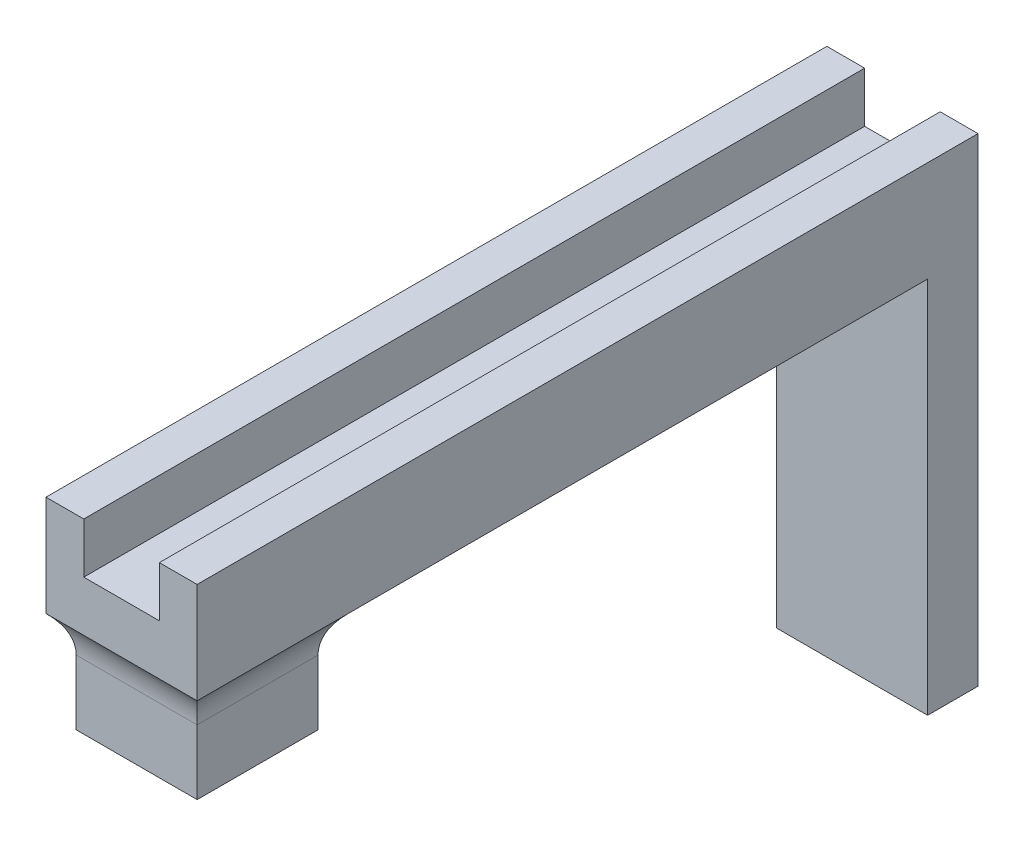
from build123d import *

# Parameters (mm, degrees)
SKETCH1_W           = 6.096
SKETCH1_H           = 6.096
BOSS_EXTRUDE1_DEPTH = 5.08
SKETCH2_W           = 7.62
SKETCH2_H           = 7.62
BOSS_EXTRUDE2_DEPTH = 5.08
FILLET1_R           = 2.54
FILLET2_R           = 2.54
SKETCH4_W           = 7.62
SKETCH4_H           = 5.08
BOSS_EXTRUDE4_DEPTH = 31.75
SKETCH5_W           = 3.81
SKETCH5_H           = 39.37
CUT_EXTRUDE1_DEPTH  = 2.54
SKETCH7_W           = 7.62
SKETCH7_H           = 2.54
BOSS_EXTRUDE5_DEPTH = 19.05


with BuildPart() as part:
    # Sketch1 → Boss-Extrude1 (new body)
    with BuildSketch(Plane(origin=(0, 0, 0), x_dir=(1, 0, 0), z_dir=(0, 1, 0))):
        with Locations((3.048, 3.048)):
            Rectangle(SKETCH1_W, SKETCH1_H)
    extrude(amount=BOSS_EXTRUDE1_DEPTH)

    # Sketch2 → Boss-Extrude2 (add)
    with BuildSketch(Plane(origin=(0, 5.08, 0), x_dir=(1, 0, 0), z_dir=(0, 1, 0))):
        with Locations((3.048, 3.048)):
            Rectangle(SKETCH2_W, SKETCH2_H)
    extrude(amount=BOSS_EXTRUDE2_DEPTH)

    # Fillet1
    # the kernel refuses this fillet: 2.54 mm, written as the material it adds along each edge
    with BuildSketch(Plane(origin=(0, 5.08, -6.096), x_dir=(-1, 0, 0), z_dir=(0, 0, 1))) as fillet1_piece_1:
        with BuildLine():
            CenterArc((2.54, 1.813922821), FILLET1_R, 180, 45.572995999)
            Line((0, 1.813922821), (-0.0508, 1.813922821))
            Line((-0.0508, 1.813922821), (-0.0508, 0))
            Line((-0.0508, 0), (0, -0.0508))
            ThreePointArc((0, -0.0508), (0.381, -0.0508), (0.72644, -0.036278456))
            Line((0.72644, -0.036278456), (0.762, 0))
        make_face()
    extrude(amount=6.096)

    # Fillet2
    # the kernel refuses this fillet: 2.54 mm, written as the material it adds along each edge
    with BuildSketch(Plane(origin=(6.096, 5.08, 0), x_dir=(0, -1, 0), z_dir=(-1, 0, 0))) as fillet2_piece_1_section:
        with BuildLine():
            CenterArc((1.813922821, 2.54), FILLET2_R, 224.427004001, 45.572995999)
            Line((0, 0.762), (-0.036278456, 0.72644))
            ThreePointArc((-0.036278456, 0.72644), (-0.0508, 0.381), (-0.0508, 0))
            Line((-0.0508, 0), (0, -0.0508))
            Line((0, -0.0508), (1.813922821, -0.0508))
            Line((1.813922821, -0.0508), (1.813922821, 0))
        make_face()
    fillet2_piece_1 = extrude(amount=6.858, mode=Mode.PRIVATE)
    fillet2_piece_1 = fillet2_piece_1 - Plane(origin=(-2.54, 3.266077179, 0.188412047), x_dir=(-1, 0, 0), z_dir=(0, 0, -1)) * Cylinder(2.54, 21, mode=Mode.PRIVATE)
    add(fillet2_piece_1)
    with BuildSketch(Plane(origin=(6.096, 5.08, 0), x_dir=(0, -1, 0), z_dir=(0, 0, -1))) as fillet2_piece_2:
        with BuildLine():
            CenterArc((1.813922821, -2.54), FILLET2_R, 90, 45.572995999)
            Line((0, -0.762), (-0.036278456, -0.72644))
            ThreePointArc((-0.036278456, -0.72644), (-0.0508, -0.381), (-0.0508, 0))
            Line((-0.0508, 0), (0, 0.0508))
            Line((0, 0.0508), (1.813922821, 0.0508))
            Line((1.813922821, 0.0508), (1.813922821, 0))
        make_face()
    extrude(amount=6.096)
    with BuildSketch(Plane(origin=(-0.762, 5.08, -6.096), x_dir=(0, 0, -1), z_dir=(1, 0, 0))) as fillet2_piece_3_section:
        with BuildLine():
            CenterArc((2.54, -1.813922821), FILLET2_R, 134.427004001, 45.572995999)
            Line((0, -1.813922821), (-0.0508, -1.813922821))
            Line((-0.0508, -1.813922821), (-0.0508, 0))
            Line((-0.0508, 0), (0, 0.0508))
            ThreePointArc((0, 0.0508), (0.381, 0.0508), (0.72644, 0.036278456))
            Line((0.72644, 0.036278456), (0.762, 0))
        make_face()
    fillet2_piece_3 = extrude(amount=6.858, mode=Mode.PRIVATE)
    fillet2_piece_3 = fillet2_piece_3 - Plane(origin=(-2.54, 3.266077179, -6.345051063), x_dir=(-1, 0, 0), z_dir=(0, 0, -1)) * Cylinder(2.54, 21, mode=Mode.PRIVATE)
    add(fillet2_piece_3)
    with BuildSketch(Plane(origin=(10.630807052, 5.08, 0), x_dir=(0, -1, 0), z_dir=(-1, 0, 0))) as fillet2_piece_4a_section:
        with BuildLine():
            CenterArc((1.813922821, 2.54), FILLET2_R, 224.427004001, 45.572995999)
            Line((0, 0.762), (-0.036278456, 0.72644))
            ThreePointArc((-0.036278456, 0.72644), (-0.0508, 0.381), (-0.0508, 0))
            Line((-0.0508, 0), (0, -0.0508))
            Line((0, -0.0508), (1.813922821, -0.0508))
            Line((1.813922821, -0.0508), (1.813922821, 0))
        make_face()
    fillet2_piece_4a = extrude(amount=11.392807052, mode=Mode.PRIVATE)
    fillet2_piece_4a = split(fillet2_piece_4a, bisect_by=Plane(origin=(6.096, 4.594869389, 0.188412047), z_dir=(1, 0, 0)), keep=Keep.TOP, mode=Mode.PRIVATE)
    fillet2_piece_4a = split(fillet2_piece_4a, bisect_by=Plane(origin=(6.858, 4.594869389, 0.188412047), z_dir=(-1, 0, 0)), keep=Keep.TOP, mode=Mode.PRIVATE)
    with BuildSketch(Plane(origin=(6.096, 5.08, 4.534807052), x_dir=(0, -1, 0), z_dir=(0, 0, -1))) as fillet2_piece_4b_section:
        with BuildLine():
            CenterArc((1.813922821, -2.54), FILLET2_R, 90, 45.572995999)
            Line((0, -0.762), (-0.036278456, -0.72644))
            ThreePointArc((-0.036278456, -0.72644), (-0.0508, -0.381), (-0.0508, 0))
            Line((-0.0508, 0), (0, 0.0508))
            Line((0, 0.0508), (1.813922821, 0.0508))
            Line((1.813922821, 0.0508), (1.813922821, 0))
        make_face()
    fillet2_piece_4b = extrude(amount=10.630807052, mode=Mode.PRIVATE)
    fillet2_piece_4b = split(fillet2_piece_4b, bisect_by=Plane(origin=(6.284412047, 4.594869389, 0), z_dir=(0, 0, 1)), keep=Keep.TOP, mode=Mode.PRIVATE)
    fillet2_piece_4b = split(fillet2_piece_4b, bisect_by=Plane(origin=(6.284412047, 4.594869389, 0.762), z_dir=(0, 0, -1)), keep=Keep.TOP, mode=Mode.PRIVATE)
    fillet2_piece_4 = fillet2_piece_4a & fillet2_piece_4b
    add(fillet2_piece_4)
    with BuildSketch(Plane(origin=(6.096, 5.08, 0), x_dir=(0, -1, 0), z_dir=(0, 0, -1))) as fillet2_piece_5a_section:
        with BuildLine():
            CenterArc((1.813922821, -2.54), FILLET2_R, 90, 45.572995999)
            Line((0, -0.762), (-0.036278456, -0.72644))
            ThreePointArc((-0.036278456, -0.72644), (-0.0508, -0.381), (-0.0508, 0))
            Line((-0.0508, 0), (0, 0.0508))
            Line((0, 0.0508), (1.813922821, 0.0508))
            Line((1.813922821, 0.0508), (1.813922821, 0))
        make_face()
    fillet2_piece_5a = extrude(amount=10.630807052, mode=Mode.PRIVATE)
    fillet2_piece_5a = split(fillet2_piece_5a, bisect_by=Plane(origin=(6.284412047, 4.594869389, -6.096), z_dir=(0, 0, -1)), keep=Keep.TOP, mode=Mode.PRIVATE)
    fillet2_piece_5a = split(fillet2_piece_5a, bisect_by=Plane(origin=(6.284412047, 4.594869389, -6.858), z_dir=(0, 0, 1)), keep=Keep.TOP, mode=Mode.PRIVATE)
    with BuildSketch(Plane(origin=(-0.762, 5.08, -6.096), x_dir=(0, 0, -1), z_dir=(1, 0, 0))) as fillet2_piece_5b_section:
        with BuildLine():
            CenterArc((2.54, -1.813922821), FILLET2_R, 134.427004001, 45.572995999)
            Line((0, -1.813922821), (-0.0508, -1.813922821))
            Line((-0.0508, -1.813922821), (-0.0508, 0))
            Line((-0.0508, 0), (0, 0.0508))
            ThreePointArc((0, 0.0508), (0.381, 0.0508), (0.72644, 0.036278456))
            Line((0.72644, 0.036278456), (0.762, 0))
        make_face()
    fillet2_piece_5b = extrude(amount=11.392807052, mode=Mode.PRIVATE)
    fillet2_piece_5b = split(fillet2_piece_5b, bisect_by=Plane(origin=(6.096, 4.594869389, -6.284412047), z_dir=(1, 0, 0)), keep=Keep.TOP, mode=Mode.PRIVATE)
    fillet2_piece_5b = split(fillet2_piece_5b, bisect_by=Plane(origin=(6.858, 4.594869389, -6.284412047), z_dir=(-1, 0, 0)), keep=Keep.TOP, mode=Mode.PRIVATE)
    fillet2_piece_5 = fillet2_piece_5a & fillet2_piece_5b
    add(fillet2_piece_5)

    # Sketch4 → Boss-Extrude4 (add)
    with BuildSketch(Plane(origin=(0, 0, -6.858), x_dir=(-1, 0, 0), z_dir=(0, 0, -1))):
        with Locations((-3.048, 7.62)):
            Rectangle(SKETCH4_W, SKETCH4_H)
    extrude(amount=BOSS_EXTRUDE4_DEPTH)

    # Sketch5 → Cut-Extrude1 (cut)
    with BuildSketch(Plane(origin=(0, 10.16, 0), x_dir=(1, 0, 0), z_dir=(0, 1, 0))):
        with Locations((3.048, 18.923)):
            Rectangle(SKETCH5_W, SKETCH5_H)
    extrude(amount=-CUT_EXTRUDE1_DEPTH, mode=Mode.SUBTRACT)

    # Sketch7 → Boss-Extrude5 (add)
    with BuildSketch(Plane.XZ.offset(-5.08)):
        with Locations((3.048, -37.338)):
            Rectangle(SKETCH7_W, SKETCH7_H)
    extrude(amount=BOSS_EXTRUDE5_DEPTH)


solid = part.part
